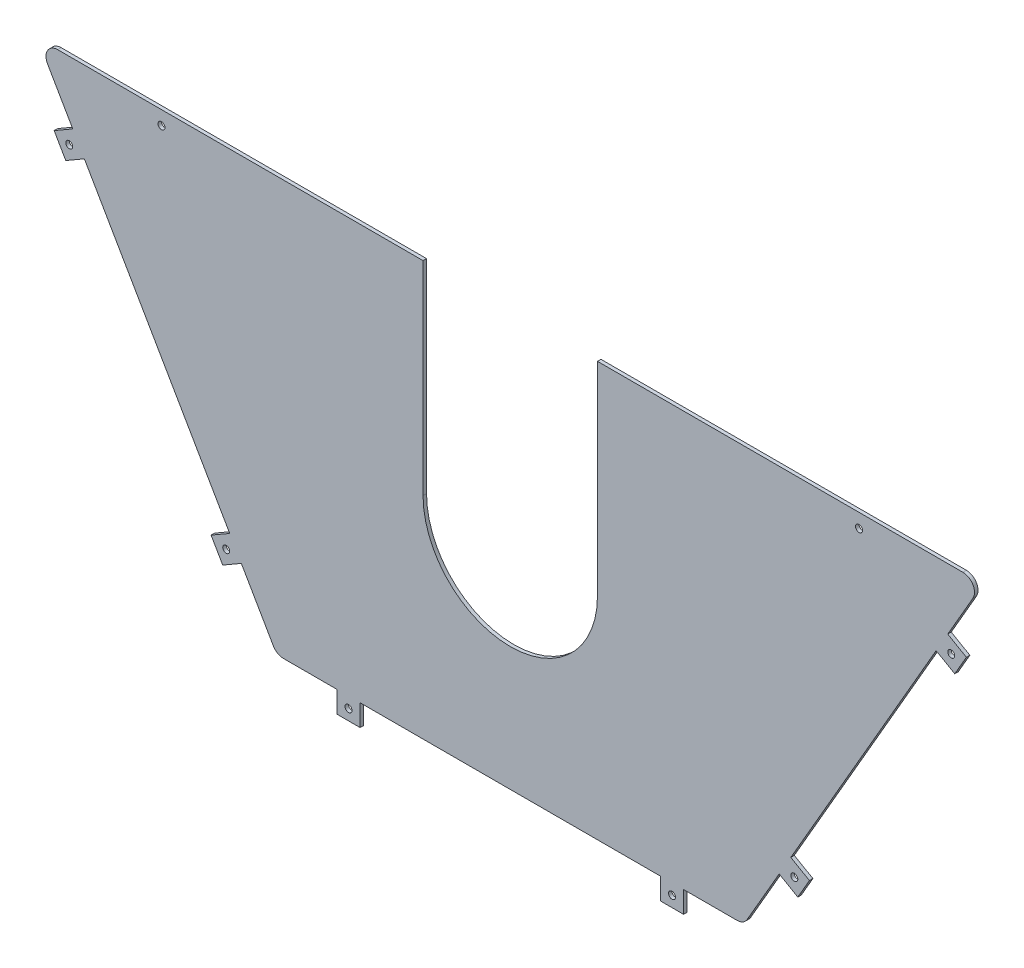
from build123d import *

# Parameters (mm, degrees)
SKETCH_1_R              = 3
EXTRUDE_1_DEPTH         = 1.5
SHEET_START             = -1.5
SHEET_METAL_1_OUTLINE_R = 3
SHEET_METAL_1_DEPTH     = 1.5


# Read off the part's stored shape, not the designer's step: Преобразовать-Твердое тело1
with BuildPart() as part:
    # Sketch 1 → Бобышка-Вытянуть1 (new body)
    with BuildSketch(Plane.XY):
        with BuildLine():
            Line((389.31902002, 22), (75, 22))
            Line((75, 22), (75, -153))
            ThreePointArc((75, -153), (0, -228), (-75, -153))
            Line((-75, -153), (-75, 22))
            Line((-75, 22), (-389.31902002, 22))
            ThreePointArc((-389.31902002, 22), (-397.979274058, 17), (-397.979274058, 7))
            Line((-397.979274058, 7), (-376.299038106, -30.551270189))
            Line((-376.299038106, -30.551270189), (-392.320508076, -39.801270189))
            Line((-392.320508076, -39.801270189), (-382.320508076, -57.121778265))
            Line((-382.320508076, -57.121778265), (-366.299038106, -47.871778265))
            Line((-366.299038106, -47.871778265), (-241.299038106, -264.378129211))
            Line((-241.299038106, -264.378129211), (-257.320508076, -273.628129211))
            Line((-257.320508076, -273.628129211), (-247.320508076, -290.948637287))
            Line((-247.320508076, -290.948637287), (-231.299038106, -281.698637287))
            Line((-231.299038106, -281.698637287), (-203.75277675, -329.410161514))
            ThreePointArc((-203.75277675, -329.410161514), (-200.092522712, -333.070415552), (-195.092522712, -334.410161514))
            Line((-195.092522712, -334.410161514), (-149.133974596, -334.410161514))
            Line((-149.133974596, -334.410161514), (-149.133974596, -352.910161514))
            Line((-149.133974596, -352.910161514), (-129.133974596, -352.910161514))
            Line((-129.133974596, -352.910161514), (-129.133974596, -334.410161514))
            Line((-129.133974596, -334.410161514), (129.133974596, -334.410161514))
            Line((129.133974596, -334.410161514), (129.133974596, -352.910161514))
            Line((129.133974596, -352.910161514), (149.133974596, -352.910161514))
            Line((149.133974596, -352.910161514), (149.133974596, -334.410161514))
            Line((149.133974596, -334.410161514), (195.092522712, -334.410161514))
            ThreePointArc((195.092522712, -334.410161514), (200.092522712, -333.070415552), (203.75277675, -329.410161514))
            Line((203.75277675, -329.410161514), (231.299038106, -281.698637287))
            Line((231.299038106, -281.698637287), (247.320508076, -290.948637287))
            Line((247.320508076, -290.948637287), (257.320508076, -273.628129211))
            Line((257.320508076, -273.628129211), (241.299038106, -264.378129211))
            Line((241.299038106, -264.378129211), (366.299038106, -47.871778265))
            Line((366.299038106, -47.871778265), (382.320508076, -57.121778265))
            Line((382.320508076, -57.121778265), (392.320508076, -39.801270189))
            Line((392.320508076, -39.801270189), (376.299038106, -30.551270189))
            Line((376.299038106, -30.551270189), (397.979274058, 7))
            ThreePointArc((397.979274058, 7), (397.979274058, 17), (389.31902002, 22))
        make_face()
        with Locations((244.309773091, -277.663383249)):
            Circle(SKETCH_1_R, mode=Mode.SUBTRACT)
        with Locations((379.309773091, -43.836524227)):
            Circle(SKETCH_1_R, mode=Mode.SUBTRACT)
        with Locations((139.133974596, -343.660161514)):
            Circle(SKETCH_1_R, mode=Mode.SUBTRACT)
        with Locations((-139.133974596, -343.660161514)):
            Circle(SKETCH_1_R, mode=Mode.SUBTRACT)
        with Locations((-244.309773091, -277.663383249)):
            Circle(SKETCH_1_R, mode=Mode.SUBTRACT)
        with Locations((-379.309773091, -43.836524227)):
            Circle(SKETCH_1_R, mode=Mode.SUBTRACT)
        with Locations((300, 10)):
            Circle(SKETCH_1_R, mode=Mode.SUBTRACT)
        with Locations((-300, 10)):
            Circle(SKETCH_1_R, mode=Mode.SUBTRACT)
    extrude(amount=EXTRUDE_1_DEPTH)

    # Sheet Metal 1 outline → Sheet Metal 1 (add)
    with BuildSketch(Plane.XY.offset(SHEET_START)):
        with BuildLine():
            Line((-149.133974596, -334.410161514), (-149.133974596, -352.910161514))
            Line((-149.133974596, -352.910161514), (-129.133974596, -352.910161514))
            Line((-129.133974596, -352.910161514), (-129.133974596, -334.410161514))
            Line((-129.133974596, -334.410161514), (129.133974596, -334.410161514))
            Line((129.133974596, -334.410161514), (129.133974596, -352.910161514))
            Line((129.133974596, -352.910161514), (149.133974596, -352.910161514))
            Line((149.133974596, -352.910161514), (149.133974596, -334.410161514))
            Line((149.133974596, -334.410161514), (195.092522712, -334.410161514))
            ThreePointArc((195.092522712, -334.410161514), (200.092522712, -333.070415552), (203.75277675, -329.410161514))
            Line((203.75277675, -329.410161514), (231.299038106, -281.698637287))
            Line((231.299038106, -281.698637287), (247.320508076, -290.948637287))
            Line((247.320508076, -290.948637287), (257.320508076, -273.628129211))
            Line((257.320508076, -273.628129211), (241.299038106, -264.378129211))
            Line((241.299038106, -264.378129211), (366.299038106, -47.871778265))
            Line((366.299038106, -47.871778265), (382.320508076, -57.121778265))
            Line((382.320508076, -57.121778265), (392.320508076, -39.801270189))
            Line((392.320508076, -39.801270189), (376.299038106, -30.551270189))
            Line((376.299038106, -30.551270189), (397.979274058, 7))
            ThreePointArc((397.979274058, 7), (397.979274058, 17), (389.31902002, 22))
            Line((389.31902002, 22), (75, 22))
            Line((75, 22), (75, -153))
            ThreePointArc((75, -153), (0, -228), (-75, -153))
            Line((-75, -153), (-75, 22))
            Line((-75, 22), (-389.31902002, 22))
            ThreePointArc((-389.31902002, 22), (-397.979274058, 17), (-397.979274058, 7))
            Line((-397.979274058, 7), (-376.299038106, -30.551270189))
            Line((-376.299038106, -30.551270189), (-392.320508076, -39.801270189))
            Line((-392.320508076, -39.801270189), (-382.320508076, -57.121778265))
            Line((-382.320508076, -57.121778265), (-366.299038106, -47.871778265))
            Line((-366.299038106, -47.871778265), (-241.299038106, -264.378129211))
            Line((-241.299038106, -264.378129211), (-257.320508076, -273.628129211))
            Line((-257.320508076, -273.628129211), (-247.320508076, -290.948637287))
            Line((-247.320508076, -290.948637287), (-231.299038106, -281.698637287))
            Line((-231.299038106, -281.698637287), (-203.75277675, -329.410161514))
            ThreePointArc((-203.75277675, -329.410161514), (-200.092522712, -333.070415552), (-195.092522712, -334.410161514))
            Line((-195.092522712, -334.410161514), (-149.133974596, -334.410161514))
        make_face()
        with Locations((-244.309773091, -277.663383249)):
            Circle(SHEET_METAL_1_OUTLINE_R, mode=Mode.SUBTRACT)
        with Locations((-139.133974596, -343.660161514)):
            Circle(SHEET_METAL_1_OUTLINE_R, mode=Mode.SUBTRACT)
        with Locations((139.133974596, -343.660161514)):
            Circle(SHEET_METAL_1_OUTLINE_R, mode=Mode.SUBTRACT)
        with Locations((244.309773091, -277.663383249)):
            Circle(SHEET_METAL_1_OUTLINE_R, mode=Mode.SUBTRACT)
        with Locations((-379.309773091, -43.836524227)):
            Circle(SHEET_METAL_1_OUTLINE_R, mode=Mode.SUBTRACT)
        with Locations((-300, 10)):
            Circle(SHEET_METAL_1_OUTLINE_R, mode=Mode.SUBTRACT)
        with Locations((379.309773091, -43.836524227)):
            Circle(SHEET_METAL_1_OUTLINE_R, mode=Mode.SUBTRACT)
        with Locations((300, 10)):
            Circle(SHEET_METAL_1_OUTLINE_R, mode=Mode.SUBTRACT)
    extrude(amount=SHEET_METAL_1_DEPTH)


solid = part.part
